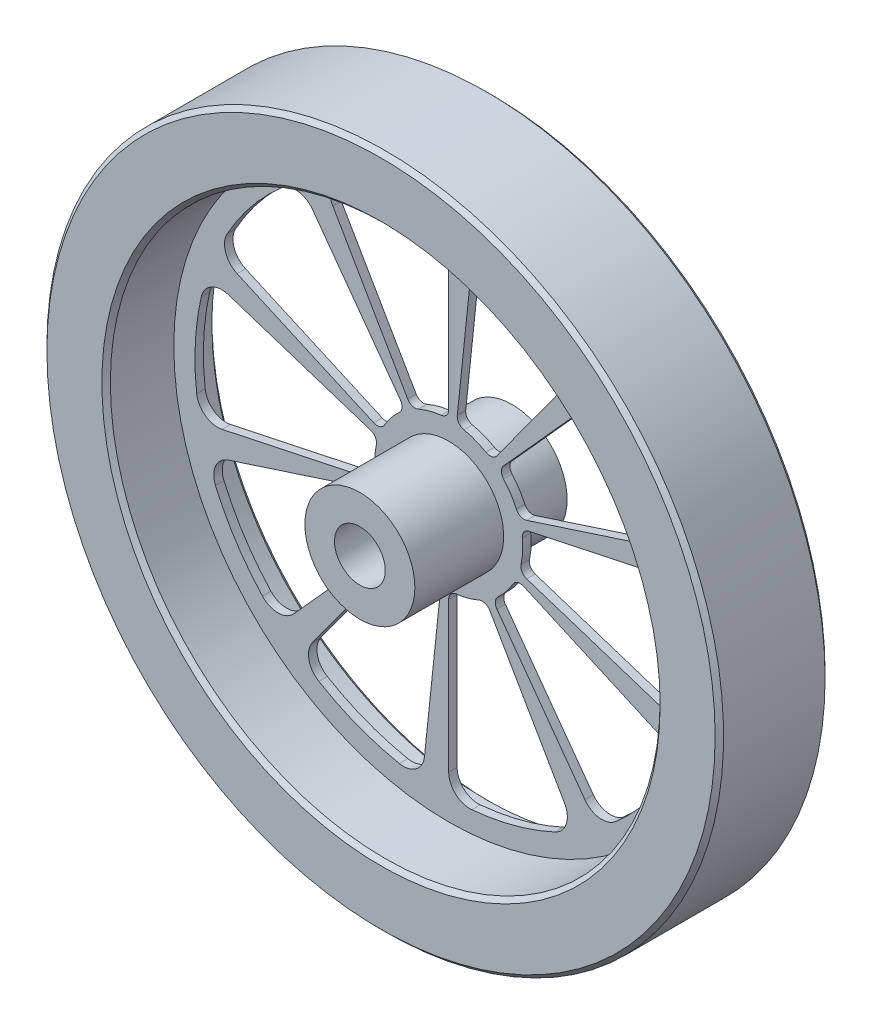
from build123d import *

# Parameters (mm, degrees)
SKETCH1_R             = 80
SKETCH1_R_2           = 6
BOSS_EXTRUDE1_DEPTH   = 13
SKETCH2_R             = 65
CUT_EXTRUDE1_DEPTH    = 8
MIRROR1_START         = -13
MIRROR1_OUTLINE_R     = 65
MIRROR1_OUTLINE_R_2   = 6
MIRROR1_DEPTH         = 8
MIRROR1_START_2       = -3
MIRROR1_2_OUTLINE_R   = 65
MIRROR1_2_OUTLINE_R_2 = 6
MIRROR1_2_DEPTH       = 8
SKETCH3_R             = 13
SKETCH3_R_2           = 6
BOSS_EXTRUDE2_DEPTH   = 18
CHAMFER1_SIZE         = 1
CUT_EXTRUDE2_DEPTH    = 116.06954419
CIRPATTERN1_COUNT     = 10


# Read off the part's stored shape, not the designer's step: Mirror1
with BuildPart() as part:
    # Sketch1 → Boss-Extrude1 (new, symmetric)
    with BuildSketch(Plane.XY):
        with Locations(Location((0, 0, 0), (0, 0, 180))):
            Circle(SKETCH1_R)
        with Locations(Location((0, 0, 0), (0, 0, 180))):
            Circle(SKETCH1_R_2, mode=Mode.SUBTRACT)
    extrude(amount=BOSS_EXTRUDE1_DEPTH, both=True)

    # Sketch2 → Cut-Extrude1 (cut)
    with BuildSketch(Plane.XY.offset(13)):
        Circle(SKETCH2_R)
    extrude(amount=-CUT_EXTRUDE1_DEPTH, mode=Mode.SUBTRACT)

    # Mirror1 outline → Mirror1 (cut)
    with BuildSketch(Plane.XY.offset(MIRROR1_START)):
        Circle(MIRROR1_OUTLINE_R)
        Circle(MIRROR1_OUTLINE_R_2, mode=Mode.SUBTRACT)
    extrude(amount=MIRROR1_DEPTH, mode=Mode.SUBTRACT)

    # Mirror1 2 outline → Mirror1 2 (cut)
    with BuildSketch(Plane.XY.offset(MIRROR1_START_2)):
        Circle(MIRROR1_2_OUTLINE_R)
        Circle(MIRROR1_2_OUTLINE_R_2, mode=Mode.SUBTRACT)
    extrude(amount=MIRROR1_2_DEPTH, mode=Mode.SUBTRACT)

    # Sketch3 → Boss-Extrude2 (add, symmetric)
    with BuildSketch(Plane.XY):
        with Locations(Location((0, 0, 0), (0, 0, 180))):
            Circle(SKETCH3_R)
        with Locations(Location((0, 0, 0), (0, 0, 180))):
            Circle(SKETCH3_R_2, mode=Mode.SUBTRACT)
    extrude(amount=BOSS_EXTRUDE2_DEPTH, both=True)

    # Chamfer1
    chamfer1_edges = [part.edges().sort_by_distance(p)[0] for p in [
        (-65, 0, 13),
        (-65, 0, -13),
        (80, 0, -13),
        (80, 0, 13),
    ]]
    chamfer(chamfer1_edges, length=CHAMFER1_SIZE)

    # Sketch4 → Cut-Extrude2 (cut, through all)
    with BuildSketch(Plane.XY.offset(-3)):
        with BuildLine():
            Line((0, 19.397164741), (0, 54.772255751))
            ThreePointArc((0, 54.772255751), (-1.629000688, 58.46500048), (-5.454545455, 59.751551728))
            ThreePointArc((-5.454545455, 59.751551728), (-15.529142706, 57.955549577), (-25.152000934, 54.473634439))
            ThreePointArc((-25.152000934, 54.473634439), (-27.821744262, 51.446675992), (-27.386127875, 47.434164903))
            Line((-27.386127875, 47.434164903), (-9.698582371, 16.798437427))
            ThreePointArc((-9.698582371, 16.798437427), (-8.582686936, 15.895715021), (-7.149451403, 15.972956666))
            ThreePointArc((-7.149451403, 15.972956666), (-4.529333289, 16.90370196), (-1.794871795, 17.407711947))
            ThreePointArc((-1.794871795, 17.407711947), (-0.515032591, 18.057436487), (0, 19.397164741))
        make_face()
    cut_extrude2 = extrude(amount=-CUT_EXTRUDE2_DEPTH, mode=Mode.SUBTRACT)

    # CirPattern1: Cut-Extrude2 ×10 about axis
    cirpattern1_axis = Axis((0, 0, 0), (0, 0, 1))
    for i in range(1, CIRPATTERN1_COUNT):
        add(cut_extrude2.rotate(cirpattern1_axis, i * 360 / CIRPATTERN1_COUNT), mode=Mode.SUBTRACT)


solid = part.part
